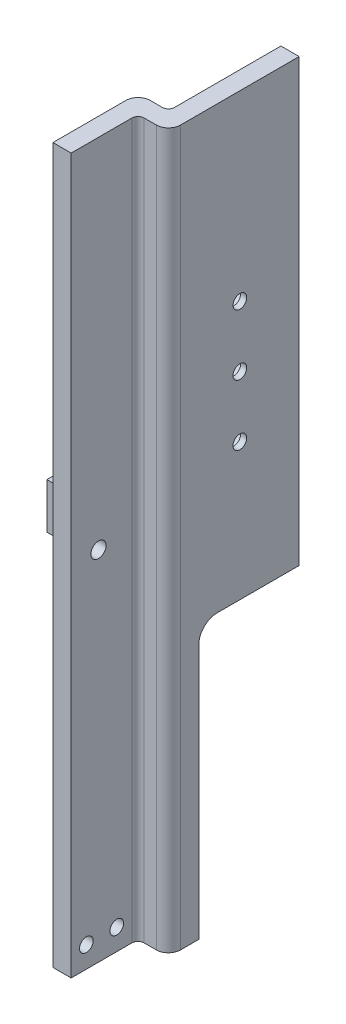
from build123d import *

# Parameters (mm, degrees)
SCHIZZO1_W                                           = 65
SCHIZZO1_H                                           = 235
ESTRUSIONE_ESTRUSIONE1_DEPTH                         = 16
SCHIZZO2_W                                           = 10
SCHIZZO2_H                                           = 37
TAGLIO_ESTRUSIONE1_DEPTH                             = 239.105018847
SCHIZZO3_W                                           = 33
SCHIZZO3_H                                           = 90
TAGLIO_ESTRUSIONE2_DEPTH                             = 239.432380351
SCHIZZO4_W                                           = 10
SCHIZZO4_H                                           = 22
TAGLIO_ESTRUSIONE3_DEPTH                             = 239.105018847
FORO_LAMATO_PER_VITE_M4_A_TESTA_ESAGONAL_D           = 4.5
FORO_LAMATO_PER_VITE_M4_A_TESTA_ESAGONAL_CBORE_D     = 8
FORO_LAMATO_PER_VITE_M4_A_TESTA_ESAGONAL_CBORE_DEPTH = 4
RACCORDO1_R                                          = 2
RACCORDO2_R                                          = 4
RACCORDO3_R                                          = 6
FORO_PER_VITE_M4_1_D                                 = 4.5
FORO_PER_VITE_M4_1_DEPTH                             = 188
FORO_PER_VITE_M4_1_TIP                               = 1.351936393
SCHIZZO10_W                                          = 3
SCHIZZO10_H                                          = 15
ESTRUSIONE_ESTRUSIONE2_DEPTH                         = 15
SCHIZZO11_R                                          = 2.5
TAGLIO_ESTRUSIONE4_DEPTH                             = 10
SMUSSO1_SIZE                                         = 8


with BuildPart() as part:
    # Schizzo1 → Estrusione-Estrusione1 (new body)
    with BuildSketch(Plane(origin=(6, 0, 0), x_dir=(0, 0, -1), z_dir=(1, 0, 0))):
        with Locations((4.5, 117.5)):
            Rectangle(SCHIZZO1_W, SCHIZZO1_H)
    extrude(amount=-ESTRUSIONE_ESTRUSIONE1_DEPTH)

    # Schizzo2 → Taglio-Estrusione1 (cut, through all)
    with BuildSketch(Plane.XZ):
        with Locations((-5, -18.5)):
            Rectangle(SCHIZZO2_W, SCHIZZO2_H)
    extrude(amount=-TAGLIO_ESTRUSIONE1_DEPTH, mode=Mode.SUBTRACT)

    # Schizzo3 → Taglio-Estrusione2 (cut, through all)
    with BuildSketch(Plane(origin=(6, 0, 0), x_dir=(0, 0, -1), z_dir=(1, 0, 0))):
        with Locations((20.5, 45)):
            Rectangle(SCHIZZO3_W, SCHIZZO3_H)
    extrude(amount=-TAGLIO_ESTRUSIONE2_DEPTH, mode=Mode.SUBTRACT)

    # Schizzo4 → Taglio-Estrusione3 (cut, through all)
    with BuildSketch(Plane.XZ):
        with Locations((1, 17)):
            Rectangle(SCHIZZO4_W, SCHIZZO4_H)
    extrude(amount=-TAGLIO_ESTRUSIONE3_DEPTH, mode=Mode.SUBTRACT)

    # Foro lamato per Vite M4 a testa esagonale-1 (through all)
    with Locations(Plane.ZY):
        with Locations((-17.5, 175), (-17.5, 155), (-17.5, 135)):
            CounterBoreHole(FORO_LAMATO_PER_VITE_M4_A_TESTA_ESAGONAL_D / 2, FORO_LAMATO_PER_VITE_M4_A_TESTA_ESAGONAL_CBORE_D / 2, FORO_LAMATO_PER_VITE_M4_A_TESTA_ESAGONAL_CBORE_DEPTH)

    # Raccordo1
    raccordo1_edges = [part.edges().sort_by_distance(p)[0] for p in [
        (0, 117.5, 0),
        (-4, 117.5, 6),
    ]]
    fillet(raccordo1_edges, radius=RACCORDO1_R)

    # Raccordo2
    raccordo2_edges = [part.edges().sort_by_distance(p)[0] for p in [
        (-10, 117.5, 0),
        (6, 117.5, 6),
    ]]
    fillet(raccordo2_edges, radius=RACCORDO2_R)

    # Raccordo3
    raccordo3_edges = [part.edges().sort_by_distance(p)[0] for p in [
        (3, 90, -4),
    ]]
    fillet(raccordo3_edges, radius=RACCORDO3_R)

    # Foro per Vite M4-1
    with Locations(Plane(origin=(-4, 0, 0), x_dir=(0, 0, -1), z_dir=(1, 0, 0))):
        with Locations((-23, 7), (-13, 7)):
            Hole(FORO_PER_VITE_M4_1_D / 2, depth=FORO_PER_VITE_M4_1_DEPTH)
            with Locations((0, 0, -(FORO_PER_VITE_M4_1_DEPTH + FORO_PER_VITE_M4_1_TIP / 2))):  # 118° drill point
                Cone(0, FORO_PER_VITE_M4_1_D / 2, FORO_PER_VITE_M4_1_TIP, mode=Mode.SUBTRACT)

    # Schizzo10 → Estrusione-Estrusione2 (add)
    with BuildSketch(Plane.ZY.offset(10)):
        with Locations((13.5, 117.5)):
            Rectangle(SCHIZZO10_W, SCHIZZO10_H)
    extrude(amount=ESTRUSIONE_ESTRUSIONE2_DEPTH)

    # Schizzo11 → Taglio-Estrusione4 (cut)
    with BuildSketch(Plane.ZY.offset(10)):
        with Locations((19, 117.5)):
            Circle(SCHIZZO11_R)
    extrude(amount=-TAGLIO_ESTRUSIONE4_DEPTH, mode=Mode.SUBTRACT)

    # Smusso1
    smusso1_edges = [part.edges().sort_by_distance(p)[0] for p in [
        (-10, 117.5, 12),
    ]]
    chamfer(smusso1_edges, length=SMUSSO1_SIZE - 0.0001)  # a hair under: the kernel refuses the full size


solid = part.part
